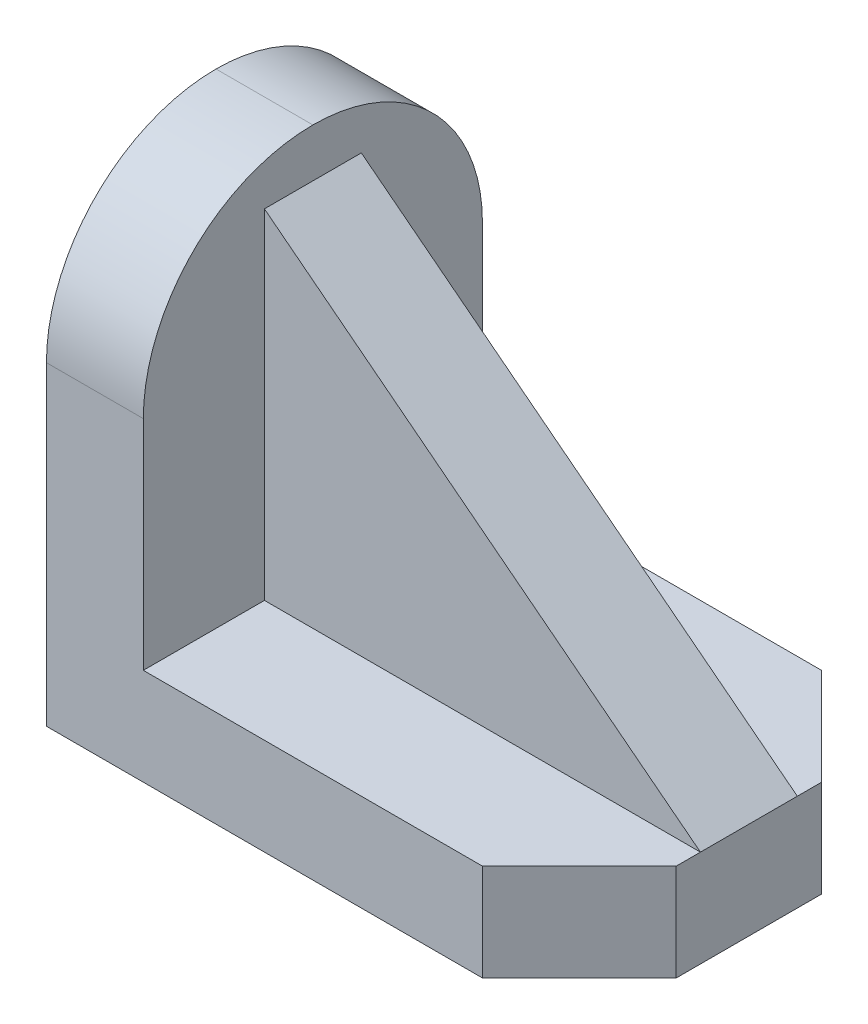
from build123d import *

# Parameters (mm, degrees)
SKETCH1_W           = 1676.4
SKETCH1_H           = 1066.8
BOSS_EXTRUDE1_DEPTH = 304.8
SKETCH2_W           = 1066.8
SKETCH2_H           = 1524
BOSS_EXTRUDE2_DEPTH = 304.8
FILLET1_R           = 533.4
SKETCH5_W           = 1371.6
SKETCH5_H           = 304.8
BOSS_EXTRUDE3_DEPTH = 1066.8
CUT_EXTRUDE1_DEPTH  = 1066.8
CHAMFER1_SIZE       = 304.8


with BuildPart() as part:
    # Sketch1 → Boss-Extrude1 (new body)
    with BuildSketch(Plane(origin=(0, 0, 0), x_dir=(1, 0, 0), z_dir=(0, 1, 0))):
        with Locations((838.2, 533.4)):
            Rectangle(SKETCH1_W, SKETCH1_H)
    extrude(amount=BOSS_EXTRUDE1_DEPTH)

    # Sketch2 → Boss-Extrude2 (add)
    with BuildSketch(Plane.ZY):
        with Locations((-533.4, 762)):
            Rectangle(SKETCH2_W, SKETCH2_H)
    extrude(amount=-BOSS_EXTRUDE2_DEPTH)

    # Fillet1
    fillet1_edges = [part.edges().sort_by_distance(p)[0] for p in [
        (152.4, 1524, -1066.8),
        (152.4, 1524, 0),
    ]]
    fillet(fillet1_edges, radius=FILLET1_R - 0.0001)  # a hair under: the kernel refuses the full size

    # Sketch5 → Boss-Extrude3 (add)
    with BuildSketch(Plane(origin=(0, 304.8, 0), x_dir=(1, 0, 0), z_dir=(0, 1, 0))):
        with Locations((990.6, 533.4)):
            Rectangle(SKETCH5_W, SKETCH5_H)
    extrude(amount=BOSS_EXTRUDE3_DEPTH)

    # Sketch6 → Cut-Extrude1 (cut)
    with BuildSketch(Plane.XY.offset(-381)):
        Polygon((304.8, 1371.6), (1676.4, 304.8), (1676.4, 1371.6), align=None)
    extrude(amount=-CUT_EXTRUDE1_DEPTH, mode=Mode.SUBTRACT)

    # Chamfer1
    chamfer1_edges = [part.edges().sort_by_distance(p)[0] for p in [
        (1676.4, 152.4, -1066.8),
        (1676.4, 152.4, 0),
    ]]
    chamfer(chamfer1_edges, length=CHAMFER1_SIZE)


solid = part.part
